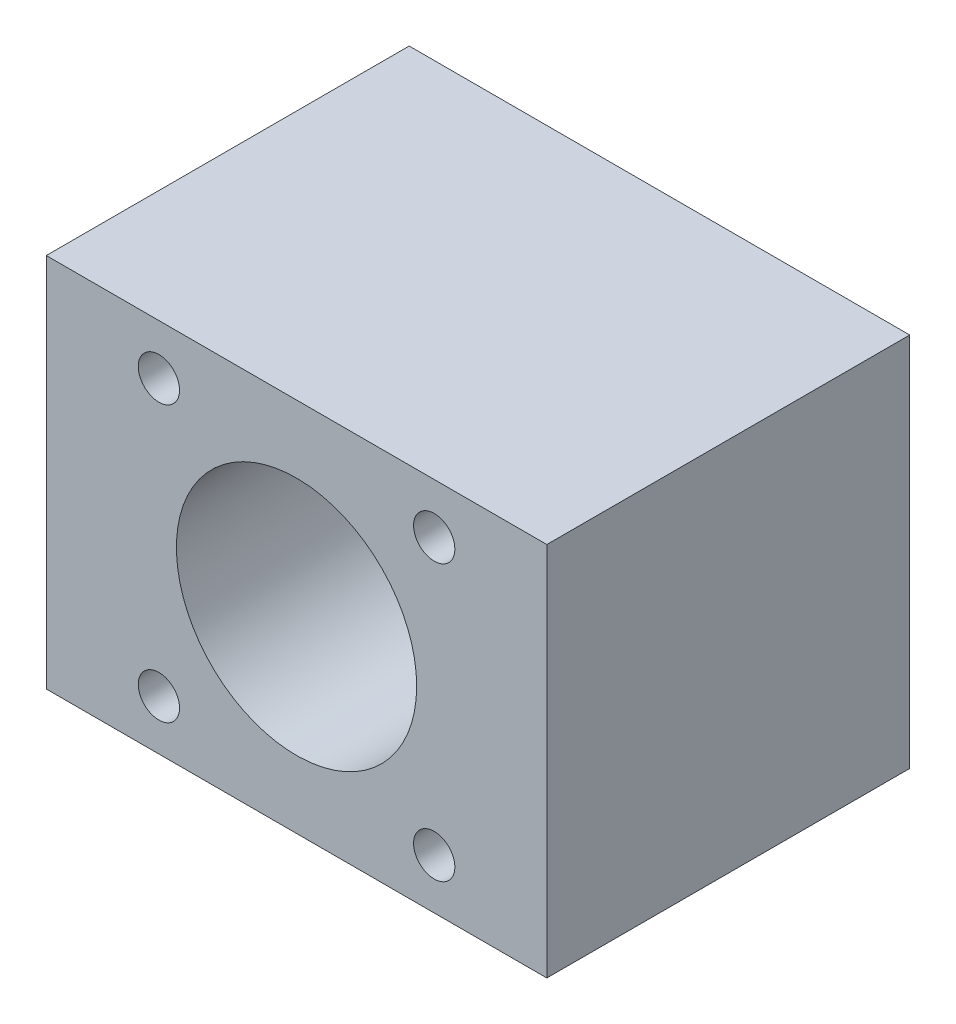
from build123d import *

# Parameters (mm, degrees)
SKETCH_1_W          = 40
SKETCH_1_H          = 30
EXTRUDE_1_DEPTH     = 29
SKETCH_2_R          = 9.6
CUT_EXTRUDE_2_DEPTH = 29
M4X0_7_1_D          = 3.3
M4X0_7_1_DEPTH      = 14.5
M4X0_7_1_TIP        = 0.991420021
M4X0_7_2_D          = 3.3
M4X0_7_2_DEPTH      = 14.5
M4X0_7_2_TIP        = 0.991420021


with BuildPart() as part:
    # ｽｹｯﾁ1 → ﾎﾞｽ - 押し出し1 (new body)
    with BuildSketch(Plane.XY):
        Rectangle(SKETCH_1_W, SKETCH_1_H)
    extrude(amount=EXTRUDE_1_DEPTH)

    # ｽｹｯﾁ2 → ｶｯﾄ - 押し出し2 (cut)
    with BuildSketch(Plane.XY.offset(29)):
        Circle(SKETCH_2_R)
    extrude(amount=-CUT_EXTRUDE_2_DEPTH, mode=Mode.SUBTRACT)

    # M4x0.7 ねじ穴1
    with Locations(Plane.XY.offset(29)):
        with Locations((-11, 11), (11, 11), (11, -11), (-11, -11)):
            Hole(M4X0_7_1_D / 2, depth=M4X0_7_1_DEPTH)
            with Locations((0, 0, -(M4X0_7_1_DEPTH + M4X0_7_1_TIP / 2))):  # 118° drill point
                Cone(0, M4X0_7_1_D / 2, M4X0_7_1_TIP, mode=Mode.SUBTRACT)

    # M4x0.7 ねじ穴2
    with Locations(Plane(origin=(0, 0, 0), x_dir=(-1, 0, 0), z_dir=(0, 0, -1))):
        with Locations((-11, 11), (11, 11), (11, -11), (-11, -11)):
            Hole(M4X0_7_2_D / 2, depth=M4X0_7_2_DEPTH)
            with Locations((0, 0, -(M4X0_7_2_DEPTH + M4X0_7_2_TIP / 2))):  # 118° drill point
                Cone(0, M4X0_7_2_D / 2, M4X0_7_2_TIP, mode=Mode.SUBTRACT)


solid = part.part
